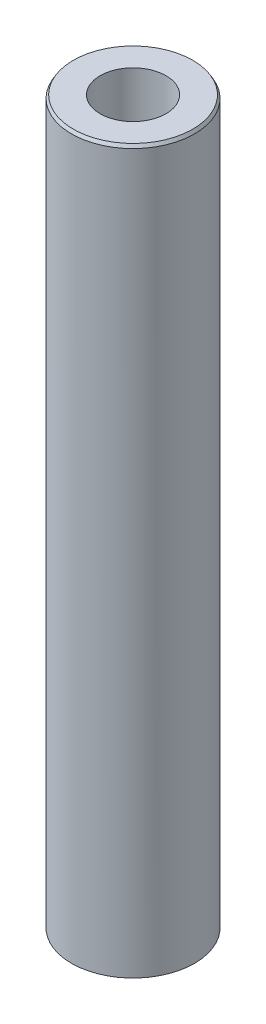
from build123d import *
from OCP.BRepFilletAPI import BRepFilletAPI_MakeChamfer

# Parameters (mm, degrees)
SKETCH1_R           = 25
BOSS_EXTRUDE1_DEPTH = 293.802868765
SKETCH2_R           = 13.38759265
CUT_EXTRUDE1_DEPTH  = 296.922499474
CHAMFER1_SIZE       = 1.285208168
CHAMFER1_SIZE2      = 0.742015281


with BuildPart() as part:
    # Sketch1 → Boss-Extrude1 (new body)
    with BuildSketch(Plane(origin=(0, 0, 0), x_dir=(1, 0, 0), z_dir=(0, 1, 0))):
        Circle(SKETCH1_R)
    extrude(amount=BOSS_EXTRUDE1_DEPTH)

    # Sketch2 → Cut-Extrude1 (cut, through all)
    with BuildSketch(Plane(origin=(0, 0, 0), x_dir=(1, 0, 0), z_dir=(0, 1, 0))):
        Circle(SKETCH2_R)
    extrude(amount=CUT_EXTRUDE1_DEPTH, mode=Mode.SUBTRACT)

    # Chamfer1: one chamfer whose edges measure the first distance from different faces: ONE call of the kernel's chamfer builder (chamfer() names one face for all edges)
    chamfer1_edges_1 = [part.edges().sort_by_distance(p)[0] for p in [
        (-25, 293.802868765, 0),
    ]]
    chamfer1_side_1 = [part.faces().sort_by_distance(p)[0] for p in [
        (-25, 146.901434383, 0),
    ]]
    chamfer1_edges_2 = [part.edges().sort_by_distance(p)[0] for p in [
        (-25, 0, 0),
    ]]
    chamfer1_side_2 = [part.faces().sort_by_distance(p)[0] for p in [
        (-24.292893219, 0, 0),
    ]]
    chamfer1 = BRepFilletAPI_MakeChamfer(part.part.solid().wrapped)
    for e in chamfer1_edges_1:
        chamfer1.Add(CHAMFER1_SIZE, CHAMFER1_SIZE2, e.wrapped, chamfer1_side_1[0].wrapped)  # the first distance lies on this face
    for e in chamfer1_edges_2:
        chamfer1.Add(CHAMFER1_SIZE, CHAMFER1_SIZE2, e.wrapped, chamfer1_side_2[0].wrapped)  # the first distance lies on this face
    add(Compound.cast(chamfer1.Shape()), mode=Mode.REPLACE)


solid = part.part
